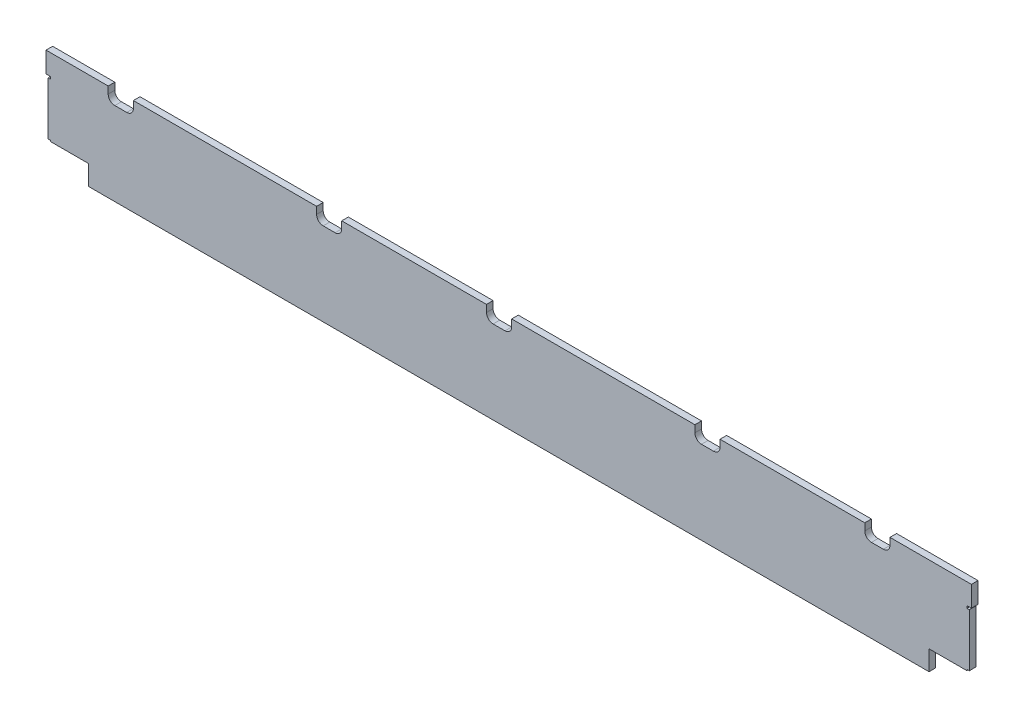
from build123d import *

# Parameters (mm, degrees)
BOSS_EXTRUDE1_DEPTH = 3.175


with BuildPart() as part:
    # Sketch2 → Boss-Extrude1 (new body)
    with BuildSketch(Plane.XY):
        with BuildLine():
            ThreePointArc((227.491320086, -163.756000107), (229.736384117, -162.826064137), (230.666320086, -160.581000107))
            Line((230.666320086, -160.581000107), (230.666320086, -157.216000107))
            Line((230.666320086, -157.216000107), (269.766820082, -157.216000107))
            Line((269.766820082, -157.216000107), (269.766820082, -167.122000107))
            Line((269.766820082, -167.122000107), (267.623820082, -167.122000107))
            Line((267.623820082, -167.122000107), (267.623820082, -168.265000107))
            Line((267.623820082, -168.265000107), (268.766820082, -168.265000107))
            Line((268.766820082, -168.265000107), (268.766820082, -193.665000107))
            Line((268.766820082, -193.665000107), (267.623820082, -193.665000107))
            Line((267.623820082, -193.665000107), (267.623820082, -194.181000107))
            Line((267.623820082, -194.181000107), (249.446820082, -194.181000107))
            Line((249.446820082, -194.181000107), (249.446820082, -203.714000107))
            Line((249.446820082, -203.714000107), (-154.179179878, -203.714000107))
            Line((-154.179179878, -203.714000107), (-154.179179878, -194.181000107))
            Line((-154.179179878, -194.181000107), (-172.356179878, -194.181000107))
            Line((-172.356179878, -194.181000107), (-172.356179878, -193.665000107))
            Line((-172.356179878, -193.665000107), (-173.499179878, -193.665000107))
            Line((-173.499179878, -193.665000107), (-173.499179878, -168.265000107))
            Line((-173.499179878, -168.265000107), (-172.356179878, -168.265000107))
            Line((-172.356179878, -168.265000107), (-172.356179878, -167.122000107))
            Line((-172.356179878, -167.122000107), (-174.499179878, -167.122000107))
            Line((-174.499179878, -167.122000107), (-174.499179878, -157.216000107))
            Line((-174.499179878, -157.216000107), (-144.641679898, -157.216000107))
            Line((-144.641679898, -157.216000107), (-144.641679898, -160.581000107))
            ThreePointArc((-144.641679898, -160.581000107), (-143.711743928, -162.826064137), (-141.466679898, -163.756000107))
            Line((-141.466679898, -163.756000107), (-135.736679898, -163.756000107))
            ThreePointArc((-135.736679898, -163.756000107), (-133.491615867, -162.826064137), (-132.561679898, -160.581000107))
            Line((-132.561679898, -160.581000107), (-132.561679898, -157.216000107))
            Line((-132.561679898, -157.216000107), (-44.596679898, -157.216000107))
            Line((-44.596679898, -157.216000107), (-44.596679898, -160.581000107))
            ThreePointArc((-44.596679898, -160.581000107), (-43.666743928, -162.826064137), (-41.421679898, -163.756000107))
            Line((-41.421679898, -163.756000107), (-35.691679898, -163.756000107))
            ThreePointArc((-35.691679898, -163.756000107), (-33.446615867, -162.826064137), (-32.516679898, -160.581000107))
            Line((-32.516679898, -160.581000107), (-32.516679898, -157.216000107))
            Line((-32.516679898, -157.216000107), (36.972320094, -157.216000107))
            Line((36.972320094, -157.216000107), (36.972320094, -160.581000107))
            ThreePointArc((36.972320094, -160.581000107), (37.902256064, -162.826064137), (40.147320094, -163.756000107))
            Line((40.147320094, -163.756000107), (45.877320094, -163.756000107))
            ThreePointArc((45.877320094, -163.756000107), (48.122384125, -162.826064137), (49.052320094, -160.581000107))
            Line((49.052320094, -160.581000107), (49.052320094, -157.216000107))
            Line((49.052320094, -157.216000107), (137.017320094, -157.216000107))
            Line((137.017320094, -157.216000107), (137.017320094, -160.581000107))
            ThreePointArc((137.017320094, -160.581000107), (137.947256064, -162.826064137), (140.192320094, -163.756000107))
            Line((140.192320094, -163.756000107), (145.922320094, -163.756000107))
            ThreePointArc((145.922320094, -163.756000107), (148.167384125, -162.826064137), (149.097320094, -160.581000107))
            Line((149.097320094, -160.581000107), (149.097320094, -157.216000107))
            Line((149.097320094, -157.216000107), (218.586320086, -157.216000107))
            Line((218.586320086, -157.216000107), (218.586320086, -160.581000107))
            ThreePointArc((218.586320086, -160.581000107), (219.516256056, -162.826064137), (221.761320086, -163.756000107))
            Line((221.761320086, -163.756000107), (227.491320086, -163.756000107))
        make_face()
    extrude(amount=BOSS_EXTRUDE1_DEPTH)


solid = part.part
